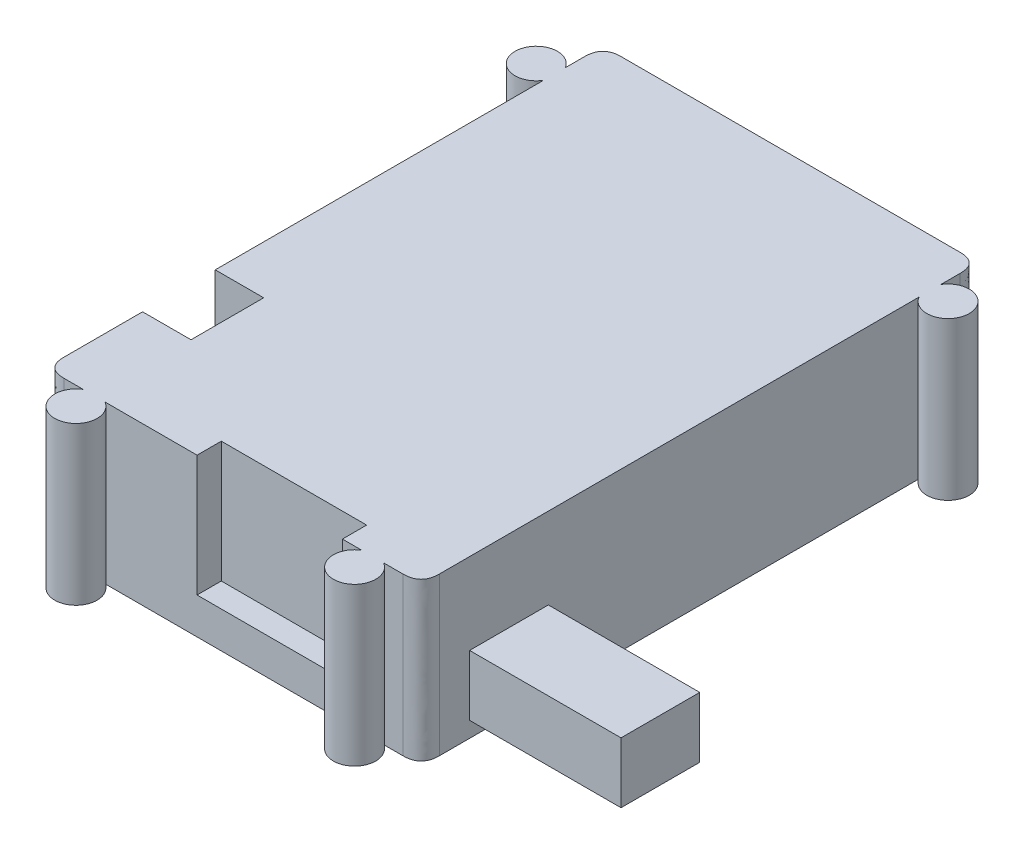
from build123d import *

# Parameters (mm, degrees)
CROQUIS1_R              = 3.5
CROQUIS1_W              = 62
CROQUIS1_H              = 92
SALIENTE_EXTRUIR1_DEPTH = 26
REDONDEO1_SIZE          = 3
CROQUIS2_W              = 13
CROQUIS2_H              = 10
CORTAR_EXTRUIR1_DEPTH   = 20
CROQUIS3_W              = 8
CROQUIS3_H              = 12
CORTAR_EXTRUIR2_DEPTH   = 20
CROQUIS4_W              = 24
CROQUIS4_H              = 4
CORTAR_EXTRUIR3_DEPTH   = 20
CROQUIS5_W              = 13
CROQUIS5_H              = 10
SALIENTE_EXTRUIR2_DEPTH = 25


with BuildPart() as part:
    # Croquis1 → Saliente-Extruir1 (new body)
    with BuildSketch(Plane(origin=(0, 0, 0), x_dir=(1, 0, 0), z_dir=(0, 1, 0))):
        with Locations((-23, -49)):
            Circle(CROQUIS1_R)
        with Locations((23, -49)):
            Circle(CROQUIS1_R)
        with Locations((34, 38)):
            Circle(CROQUIS1_R)
        with Locations((-34, 38)):
            Circle(CROQUIS1_R)
        Rectangle(CROQUIS1_W, CROQUIS1_H)
        with BuildLine():
            ThreePointArc((-21.197224362, -46), (-23, -45.5), (-24.802775638, -46))
            Line((-24.802775638, -46), (-21.197224362, -46))
        make_face()
        with BuildLine():
            Line((-21.197224362, -46), (-24.802775638, -46))
            ThreePointArc((-24.802775638, -46), (-24.723410176, -52.046285831), (-19.5, -49))
            ThreePointArc((-19.5, -49), (-19.953714169, -47.276589824), (-21.197224362, -46))
        make_face()
    extrude(amount=SALIENTE_EXTRUIR1_DEPTH)

    # Redondeo1
    # a fillet whose section is not a circle: 3 mm, written as the material it takes off along each edge
    with BuildSketch(Plane(origin=(31, -7.5, 46), x_dir=(-1, 0, 0), z_dir=(0, 1, 0)), Plane(origin=(-31, -7.5, 46), x_dir=(0, 0, -1), z_dir=(0, 1, 0)), Plane(origin=(-31, -7.5, -46), x_dir=(1, 0, 0), z_dir=(0, 1, 0)), Plane(origin=(31, -7.5, -46), x_dir=(0, 0, 1), z_dir=(0, 1, 0))) as redondeo1_piece_1:
        with BuildLine():
            Bezier((REDONDEO1_SIZE, 0), (0, 0), (0, -REDONDEO1_SIZE), weights=[1, 1, 1])
            Line((0, -REDONDEO1_SIZE), (0, 0))
            Line((0, 0), (REDONDEO1_SIZE, 0))
        make_face()
    extrude(amount=41, mode=Mode.SUBTRACT)

    # Croquis2 → Cortar-Extruir1 (cut)
    with BuildSketch(Plane(origin=(31, 0, 0), x_dir=(0, 0, -1), z_dir=(1, 0, 0))):
        with Locations((-31.5, 7.575724176)):
            Rectangle(CROQUIS2_W, CROQUIS2_H)
    extrude(amount=-CORTAR_EXTRUIR1_DEPTH, mode=Mode.SUBTRACT)

    # Croquis3 → Cortar-Extruir2 (cut)
    with BuildSketch(Plane(origin=(0, 26, 0), x_dir=(1, 0, 0), z_dir=(0, 1, 0))):
        with Locations((-27, -24)):
            Rectangle(CROQUIS3_W, CROQUIS3_H)
    extrude(amount=-CORTAR_EXTRUIR2_DEPTH, mode=Mode.SUBTRACT)

    # Croquis4 → Cortar-Extruir3 (cut)
    with BuildSketch(Plane(origin=(0, 26, 0), x_dir=(1, 0, 0), z_dir=(0, 1, 0))):
        with Locations((6, -44)):
            Rectangle(CROQUIS4_W, CROQUIS4_H)
    extrude(amount=-CORTAR_EXTRUIR3_DEPTH, mode=Mode.SUBTRACT)


with BuildPart() as body_2:
    # Croquis5 → Saliente-Extruir2 (new body)
    with BuildSketch(Plane(origin=(31, 0, 0), x_dir=(0, 0, -1), z_dir=(1, 0, 0))):
        with Locations((-31.5, 7.575724176)):
            Rectangle(CROQUIS5_W, CROQUIS5_H)
    extrude(amount=SALIENTE_EXTRUIR2_DEPTH)


solid = Compound([part.part, body_2.part])
